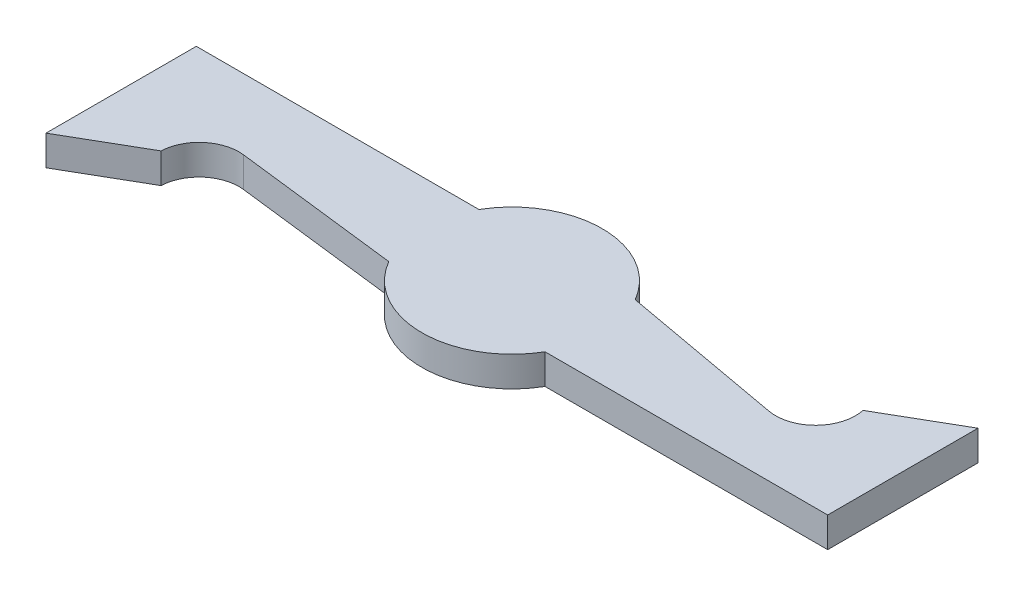
from build123d import *

# Parameters (mm, degrees)
BOSS_EXTRUDE1_DEPTH = 12.7


with BuildPart() as part:
    # Sketch1 → Boss-Extrude1 (new body)
    with BuildSketch(Plane(origin=(0, 0, 0), x_dir=(1, 0, 0), z_dir=(0, 1, 0))):
        with BuildLine():
            Line((-102.746991417, -10.669241196), (-33.003187884, -19.05))
            ThreePointArc((-33.003187884, -19.05), (-0.00762, -38.1), (32.987947884, -19.05))
            Line((32.987947884, -19.05), (152.4, -19.05))
            Line((152.4, -19.05), (152.4, 44.45))
            Line((152.4, 44.45), (121.604136641, 26.67))
            ThreePointArc((121.604136641, 26.67), (117.238657075, 11.394009783), (102.114937203, 6.527143625))
            Line((102.114937203, 6.527143625), (32.987947884, 19.05))
            ThreePointArc((32.987947884, 19.05), (-0.00762, 38.1), (-33.003187884, 19.05))
            Line((-33.003187884, 19.05), (-152.4, 19.05))
            Line((-152.4, 19.05), (-152.4, -44.45))
            Line((-152.4, -44.45), (-121.604136641, -26.67))
            ThreePointArc((-121.604136641, -26.67), (-115.668144176, -14.553560114), (-102.746991417, -10.669241196))
        make_face()
    extrude(amount=BOSS_EXTRUDE1_DEPTH)


solid = part.part
